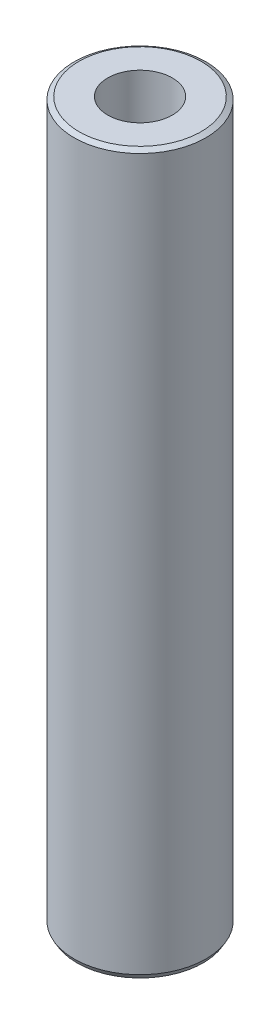
from build123d import *
from OCP.BRepFilletAPI import BRepFilletAPI_MakeChamfer

# Parameters (mm, degrees)
SKETCH1_R           = 55
BOSS_EXTRUDE1_DEPTH = 600
SKETCH2_R           = 26.949288384
CUT_EXTRUDE1_DEPTH  = 606.020660804
CHAMFER1_SIZE       = 2.34083894
CHAMFER1_SIZE2      = 4.054451976


with BuildPart() as part:
    # Sketch1 → Boss-Extrude1 (new body)
    with BuildSketch(Plane(origin=(0, 0, 0), x_dir=(1, 0, 0), z_dir=(0, 1, 0))):
        Circle(SKETCH1_R)
    extrude(amount=BOSS_EXTRUDE1_DEPTH)

    # Sketch2 → Cut-Extrude1 (cut, through all)
    with BuildSketch(Plane(origin=(0, 0, 0), x_dir=(1, 0, 0), z_dir=(0, 1, 0))):
        Circle(SKETCH2_R)
    extrude(amount=CUT_EXTRUDE1_DEPTH, mode=Mode.SUBTRACT)

    # Chamfer1: one chamfer whose edges measure the first distance from different faces: ONE call of the kernel's chamfer builder (chamfer() names one face for all edges)
    chamfer1_edges_1 = [part.edges().sort_by_distance(p)[0] for p in [
        (-55, 600, 0),
    ]]
    chamfer1_side_1 = [part.faces().sort_by_distance(p)[0] for p in [
        (-55, 300, 0),
    ]]
    chamfer1_edges_2 = [part.edges().sort_by_distance(p)[0] for p in [
        (-55, 0, 0),
    ]]
    chamfer1_side_2 = [part.faces().sort_by_distance(p)[0] for p in [
        (-53.444365081, 0, 0),
    ]]
    chamfer1 = BRepFilletAPI_MakeChamfer(part.part.solid().wrapped)
    for e in chamfer1_edges_1:
        chamfer1.Add(CHAMFER1_SIZE, CHAMFER1_SIZE2, e.wrapped, chamfer1_side_1[0].wrapped)  # the first distance lies on this face
    for e in chamfer1_edges_2:
        chamfer1.Add(CHAMFER1_SIZE, CHAMFER1_SIZE2, e.wrapped, chamfer1_side_2[0].wrapped)  # the first distance lies on this face
    add(Compound.cast(chamfer1.Shape()), mode=Mode.REPLACE)


solid = part.part
